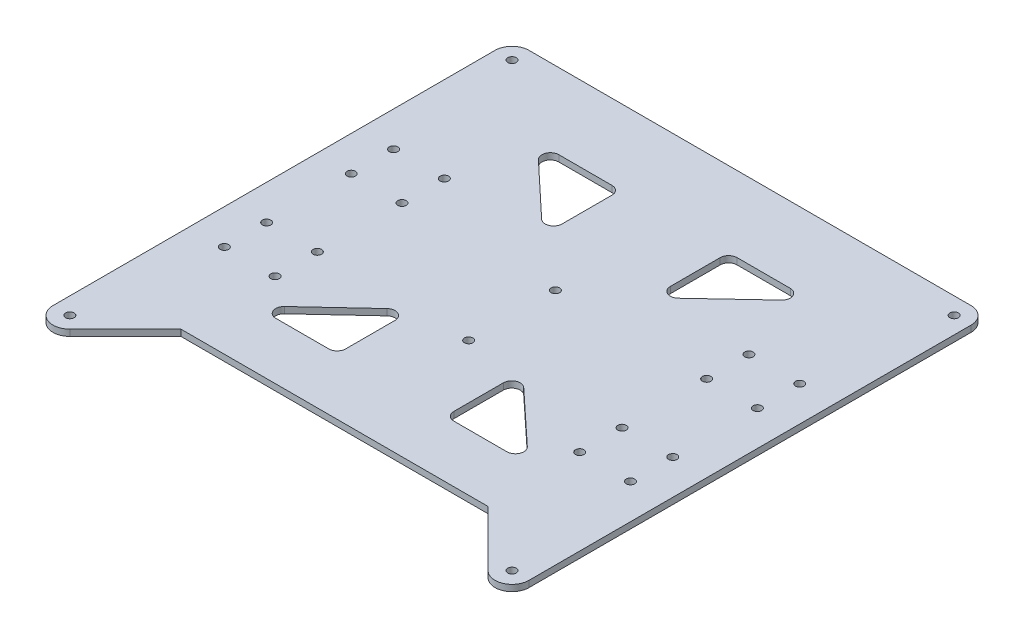
from build123d import *

# Parameters (mm, degrees)
SKETCH1_R            = 2
BOSS_EXTRUDE2_DEPTH  = 3
FILLET1_R            = 4
FILLET1_OF_MIRROR1_R = 4


with BuildPart() as part:
    # Sketch1 → Boss-Extrude2 (new body)
    with BuildSketch(Plane(origin=(0, 0, 0), x_dir=(1, 0, 0), z_dir=(0, 1, 0))):
        with BuildLine():
            Line((0, 112.499952103), (0, 22.5))
            ThreePointArc((0, 22.5), (2, 20.5), (0, 18.5))
            Line((0, 18.5), (0, -18.500095793))
            ThreePointArc((0, -18.500095793), (2, -20.500095793), (0, -22.500095793))
            Line((0, -22.500095793), (0, -83.906902146))
            Line((0, -83.906902146), (72.593143282, -83.906902146))
            Line((72.593143282, -83.906902146), (98.843143282, -110.156902146))
            ThreePointArc((98.843143282, -110.156902146), (107.56146499, -111.891084157), (112.499997532, -104.500047897))
            Line((112.499997532, -104.500047897), (112.499997532, -4.7897e-05))
            Line((112.499997532, -4.7897e-05), (112.499997532, 104.499952103))
            ThreePointArc((112.499997532, 104.499952103), (110.156851781, 110.156806353), (104.499997532, 112.499952103))
            Line((104.499997532, 112.499952103), (0, 112.499952103))
        make_face()
        with Locations((104.499997532, 104.499952103)):
            Circle(SKETCH1_R, mode=Mode.SUBTRACT)
        with Locations((104.499997532, -104.500047897)):
            Circle(SKETCH1_R, mode=Mode.SUBTRACT)
        with Locations((95.999997532, 39.999952103)):
            Circle(SKETCH1_R, mode=Mode.SUBTRACT)
        with Locations((71.999997532, 39.999952103)):
            Circle(SKETCH1_R, mode=Mode.SUBTRACT)
        with Locations((71.999997532, 19.999952103)):
            Circle(SKETCH1_R, mode=Mode.SUBTRACT)
        with Locations((95.999997532, 19.999952103)):
            Circle(SKETCH1_R, mode=Mode.SUBTRACT)
        with Locations((95.999997532, -40.000047897)):
            Circle(SKETCH1_R, mode=Mode.SUBTRACT)
        with Locations((71.999997532, -40.000047897)):
            Circle(SKETCH1_R, mode=Mode.SUBTRACT)
        with Locations((71.999997532, -20.000047897)):
            Circle(SKETCH1_R, mode=Mode.SUBTRACT)
        with Locations((95.999997532, -20.000047897)):
            Circle(SKETCH1_R, mode=Mode.SUBTRACT)
        Polygon((25.578501747, 39.999952103), (25.578501747, 76.833921846), (64.808861855, 76.833921846), align=None, mode=Mode.SUBTRACT)
        Polygon((25.578501747, -20.500095793), (25.578501747, -57.061589457), (64.808861855, -57.061589457), align=None, mode=Mode.SUBTRACT)
    boss_extrude2 = extrude(amount=BOSS_EXTRUDE2_DEPTH)

    # Fillet1
    fillet1_edges = [part.edges().sort_by_distance(p)[0] for p in [
        (64.808861855, 1.5, 57.061589457),
        (25.578501747, 1.5, 57.061589457),
        (25.578501747, 1.5, 20.500095793),
        (25.578501747, 1.5, -39.999952103),
        (25.578501747, 1.5, -76.833921846),
        (64.808861855, 1.5, -76.833921846),
    ]]
    fillet(fillet1_edges, radius=FILLET1_R)

    # Mirror1: Boss-Extrude2 across plane
    add(boss_extrude2.mirror(Plane(origin=(0, 3, -112.499952103), x_dir=(0, 0, 1), z_dir=(1, 0, 0))))

    # Fillet1 of Mirror1
    fillet1_of_mirror1_edges = [part.edges().sort_by_distance(p)[0] for p in [
        (-64.808861855, 1.5, 57.061589457),
        (-25.578501747, 1.5, 57.061589457),
        (-25.578501747, 1.5, 20.500095793),
        (-25.578501747, 1.5, -39.999952103),
        (-25.578501747, 1.5, -76.833921846),
        (-64.808861855, 1.5, -76.833921846),
    ]]
    fillet(fillet1_of_mirror1_edges, radius=FILLET1_OF_MIRROR1_R)


solid = part.part
